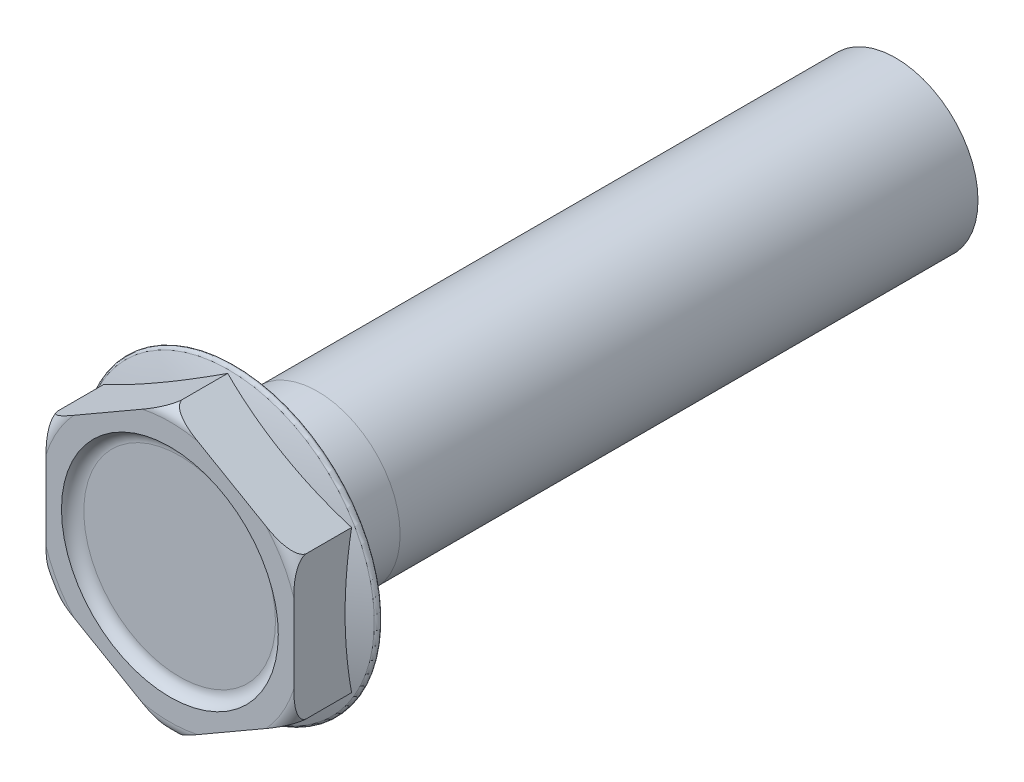
from build123d import *

# Parameters (mm, degrees)
HEAD_DEPTH     = 10
SHANK_SKETCH_R = 12.7
SHANK_DEPTH    = 101.6
SKETCH6_R      = 16.66875
HEAD_CUT_DEPTH = 1.5
FILLET1_R      = 2
FILLET2_R      = 0.5
THREAD_END_W   = 88.9
THREAD_END_H   = 0.05


with BuildPart() as part:
    # Head Sketch → Head (new body)
    with BuildSketch(Plane.XY):
        Polygon((0, 21.997045256), (19.05, 10.998522628), (19.05, -10.998522628), (0, -21.997045256), (-19.05, -10.998522628), (-19.05, 10.998522628), align=None)
    extrude(amount=HEAD_DEPTH)

    # Shank Sketch → Shank (add)
    with BuildSketch(Plane.XY):
        Circle(SHANK_SKETCH_R)
    extrude(amount=-SHANK_DEPTH)

    # Sketch3 → Flange (revolve)
    with BuildSketch(Plane(origin=(0, 0, 0), x_dir=(-1, 0, 0), z_dir=(0, 1, 0)), mode=Mode.PRIVATE) as flange_sk:
        with BuildLine():
            Line((-22.225, 0), (0, 0))
            Line((0, 0), (0, 5))
            ThreePointArc((0, 5), (-11.379608963, 3.984124175), (-22.399330603, 0.968624413))
            ThreePointArc((-22.399330603, 0.968624413), (-22.717093592, 0.411434224), (-22.225, 0))
        make_face()
    revolve(flange_sk.sketch.rotate(Axis((0, 0, 0), (0, 0, 1)), 30), axis=Axis((0, 0, 0), (0, 0, 1)))

    # Sketch5 → Head Trim (revolve, cut)
    with BuildSketch(Plane(origin=(0, 0, 0), x_dir=(0, 0, -1), z_dir=(1, 0, 0)), mode=Mode.PRIVATE) as head_trim_sk:
        with BuildLine():
            Line((-10, -19.997045256), (-10, -21.997045256))
            Line((-10, -21.997045256), (-8, -21.997045256))
            ThreePointArc((-8, -21.997045256), (-9.414213562, -21.411258818), (-10, -19.997045256))
        make_face()
    revolve(head_trim_sk.sketch.rotate(Axis((0, 0, 15.085599173), (0, 0, -1)), 90), axis=Axis((0, 0, 15.085599173), (0, 0, -1)), mode=Mode.SUBTRACT)

    # Sketch6 → Head Cut (cut)
    with BuildSketch(Plane.XY.offset(10)):
        Circle(SKETCH6_R)
    extrude(amount=-HEAD_CUT_DEPTH, mode=Mode.SUBTRACT)

    # Fillet1
    # the kernel refuses this fillet: 2 mm, written as the material it adds along each edge
    with BuildSketch(Plane(origin=(0, 0, 8.5), x_dir=(1, 0, 0), z_dir=(0, -1, 0))) as fillet1_piece_1:
        with BuildLine():
            CenterArc((14.732258327, 2), FILLET1_R, 270, 75.522487814)
            Line((14.732258327, 0), (14.732258327, -0.04))
            Line((14.732258327, -0.04), (16.66875, -0.04))
            Line((16.66875, -0.04), (16.70875, 0))
            ThreePointArc((16.70875, 0), (16.70875, 0.75), (16.707479833, 1.49))
            Line((16.707479833, 1.49), (16.66875, 1.5))
        make_face()
    revolve(axis=Axis((0, 0, 8.5), (0, 0, 1)))

    # Fillet2
    fillet2_edges = [part.edges().sort_by_distance(p)[0] for p in [
        (-12.7, 0, 0),
    ]]
    fillet(fillet2_edges, radius=FILLET2_R)

    # Thread End → Thread Cut (revolve, cut)
    with BuildSketch(Plane(origin=(0, 0, 0), x_dir=(0, 0, -1), z_dir=(1, 0, 0)), mode=Mode.PRIVATE) as thread_cut_sk:
        with Locations((57.15, 12.675)):
            Rectangle(THREAD_END_W, THREAD_END_H)
    revolve(thread_cut_sk.sketch.rotate(Axis((0, 0, -21.551935625), (0, 0, -1)), 90), axis=Axis((0, 0, -21.551935625), (0, 0, -1)), mode=Mode.SUBTRACT)


solid = part.part
